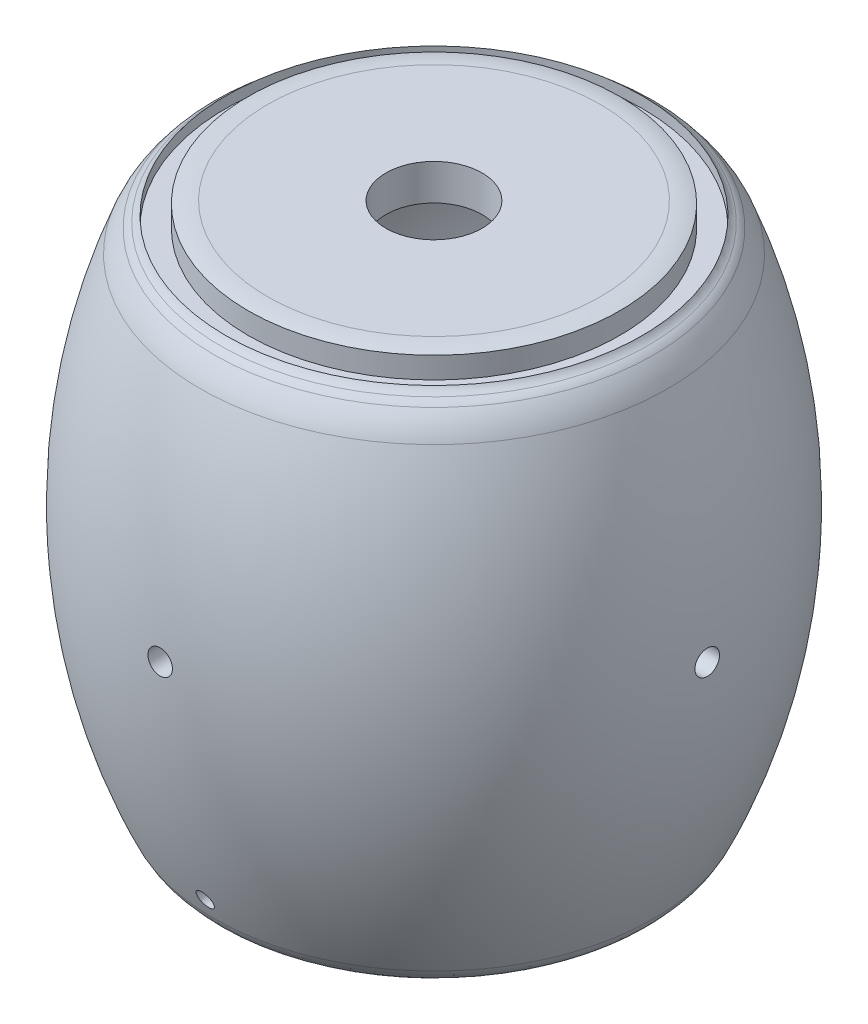
from build123d import *

# Parameters (mm, degrees)
SKETCH3_R               = 81
SKETCH3_R_2             = 77.501248024
CUT_EXTRUDE1_DEPTH      = 20
SKETCH5_R               = 20
CUT_EXTRUDE3_DEPTH      = 20
CUT_EXTRUDE4_DEPTH      = 30
CUT_EXTRUDE4_DEPTH_BACK = 410
SKETCH6_R               = 5.1
CUT_EXTRUDE5_DEPTH      = 322.036625044
CUT_EXTRUDE5_DEPTH_BACK = 322.036625044
SKETCH7_R               = 5.1
CUT_EXTRUDE6_DEPTH      = 364.804332844
CUT_EXTRUDE6_DEPTH_BACK = 12
SKETCH8_R               = 3.55
SKETCH9_R               = 86.553911163
SKETCH9_R_2             = 77.313911163
CUT_EXTRUDE7_DEPTH      = 10


with BuildPart() as part:
    # Sketch2 → Revolve1 (revolve)
    with BuildSketch(Plane.XY):
        with BuildLine():
            ThreePointArc((-3.446088837, 214.546614293), (-11.648846932, 218.604181764), (-20.693225606, 220))
            Line((-20.693225606, 220), (-90, 220))
            Line((-90, 220), (-90, 205))
            Line((-90, 205), (-20.693225606, 205))
            ThreePointArc((-20.693225606, 205), (-12.209917689, 202.370670426), (-6.700664758, 195.404464906))
            ThreePointArc((-6.700664758, 195.404464906), (8.978164508, 103.730969885), (-12.13455183, 13.154435476))
            Line((-12.13455183, 13.154435476), (-19.281789599, 12.479876035))
            Line((-19.281789599, 12.479876035), (-19.281789599, 0))
            Line((-19.281789599, 0), (-4.926165928, 0))
            ThreePointArc((-4.926165928, 0), (-1.147491573, 2.942456876), (1.511165162, 6.92591978))
            ThreePointArc((1.511165162, 6.92591978), (23.971501692, 103.283935109), (7.29189609, 200.808929812))
            ThreePointArc((7.29189609, 200.808929812), (4.841723152, 205.746948655), (1.529394516, 210.153291416))
            ThreePointArc((1.529394516, 210.153291416), (0.336924673, 211.269613546), (-1.021373152, 212.176909774))
            ThreePointArc((-1.021373152, 212.176909774), (-2.392726704, 213.199075341), (-3.446088837, 214.546614293))
        make_face()
    revolve(axis=Axis((-90, -83.445440151, 0), (0, 1, 0)))

    # Sketch3 → Cut-Extrude1 (cut)
    with BuildSketch(Plane.XZ):
        with Locations((-90, 0)):
            Circle(SKETCH3_R)
        with Locations((-90, 0)):
            Circle(SKETCH3_R_2, mode=Mode.SUBTRACT)
    extrude(amount=-CUT_EXTRUDE1_DEPTH, mode=Mode.SUBTRACT)


with BuildPart() as cut_extrude1_piece_1:
    # of the separate pieces the step leaves, piece 1, a body of its own (cut_extrude1_pieces)
    add(part.part.solids().sort_by_distance((1.511165162, 6.92591978, 0))[0])

    # Sketch2<3> → Revolve2 (revolve)
    with BuildSketch(Plane.XY):
        with BuildLine():
            ThreePointArc((-3.446088837, 214.546614293), (-11.648846932, 218.604181764), (-20.693225606, 220))
            Line((-20.693225606, 220), (-90, 220))
            Line((-90, 220), (-90, 205))
            Line((-90, 205), (-20.693225606, 205))
            ThreePointArc((-20.693225606, 205), (-12.209917689, 202.370670426), (-6.700664758, 195.404464906))
            ThreePointArc((-6.700664758, 195.404464906), (8.978164508, 103.730969885), (-12.13455183, 13.154435476))
            Line((-12.13455183, 13.154435476), (-19.281789599, 12.479876035))
            Line((-19.281789599, 12.479876035), (-19.281789599, 0))
            Line((-19.281789599, 0), (-4.926165928, 0))
            ThreePointArc((-4.926165928, 0), (-1.147491573, 2.942456876), (1.511165162, 6.92591978))
            ThreePointArc((1.511165162, 6.92591978), (23.971501692, 103.283935109), (7.29189609, 200.808929812))
            ThreePointArc((7.29189609, 200.808929812), (4.841723152, 205.746948655), (1.529394516, 210.153291416))
            ThreePointArc((1.529394516, 210.153291416), (0.336924673, 211.269613546), (-1.021373152, 212.176909774))
            ThreePointArc((-1.021373152, 212.176909774), (-2.392726704, 213.199075341), (-3.446088837, 214.546614293))
        make_face()
    revolve(axis=Axis((-90, -83.445440151, 0), (0, 1, 0)))

    # Sketch5 → Cut-Extrude3 (cut)
    with BuildSketch(Plane(origin=(0, 220, 0), x_dir=(1, 0, 0), z_dir=(0, 1, 0))):
        with Locations((-90, 0)):
            Circle(SKETCH5_R)
    extrude(amount=-CUT_EXTRUDE3_DEPTH, mode=Mode.SUBTRACT)

    # Sketch6 → Cut-Extrude4 (cut, two sides: drawn at the far end of the back side and taken through both)
    with BuildSketch(Plane.XY.offset(91.7).offset(-CUT_EXTRUDE4_DEPTH_BACK)):
        with Locations((-90, 110.734514709)):
            Circle(SKETCH6_R)
    extrude(amount=CUT_EXTRUDE4_DEPTH + CUT_EXTRUDE4_DEPTH_BACK, mode=Mode.SUBTRACT)

    # Sketch7 → Cut-Extrude5 (cut, two sides: drawn at the far end of the back side and taken through both)
    with BuildSketch(Plane(origin=(0, 0, 0), x_dir=(0, 0, -1), z_dir=(1, 0, 0)).offset(-CUT_EXTRUDE5_DEPTH_BACK)):
        with Locations((-0.244758935, 110.734514709)):
            Circle(SKETCH7_R)
    extrude(amount=CUT_EXTRUDE5_DEPTH + CUT_EXTRUDE5_DEPTH_BACK, mode=Mode.SUBTRACT)

    # Sketch8 → Cut-Extrude6 (cut, two sides: drawn at the far end of the back side and taken through both)
    with BuildSketch(Plane.XY.offset(91.7).offset(-CUT_EXTRUDE6_DEPTH_BACK)):
        with Locations((-90, 15.629680066)):
            Circle(SKETCH8_R)
    extrude(amount=CUT_EXTRUDE6_DEPTH + CUT_EXTRUDE6_DEPTH_BACK, mode=Mode.SUBTRACT)

    # Sketch9 → Cut-Extrude7 (cut)
    with BuildSketch(Plane(origin=(0, 220, 0), x_dir=(1, 0, 0), z_dir=(0, 1, 0))):
        with Locations((-90, 0)):
            Circle(SKETCH9_R)
        with Locations((-90, 0)):
            Circle(SKETCH9_R_2, mode=Mode.SUBTRACT)
    extrude(amount=-CUT_EXTRUDE7_DEPTH, mode=Mode.SUBTRACT)


with BuildPart() as cut_extrude1_piece_2:
    # of the separate pieces the step leaves, piece 2, a body of its own (cut_extrude1_pieces)
    add(part.part.solids().sort_by_distance((-12.498751976, 0, 0))[0])


solid = Compound([cut_extrude1_piece_1.part, cut_extrude1_piece_2.part])
